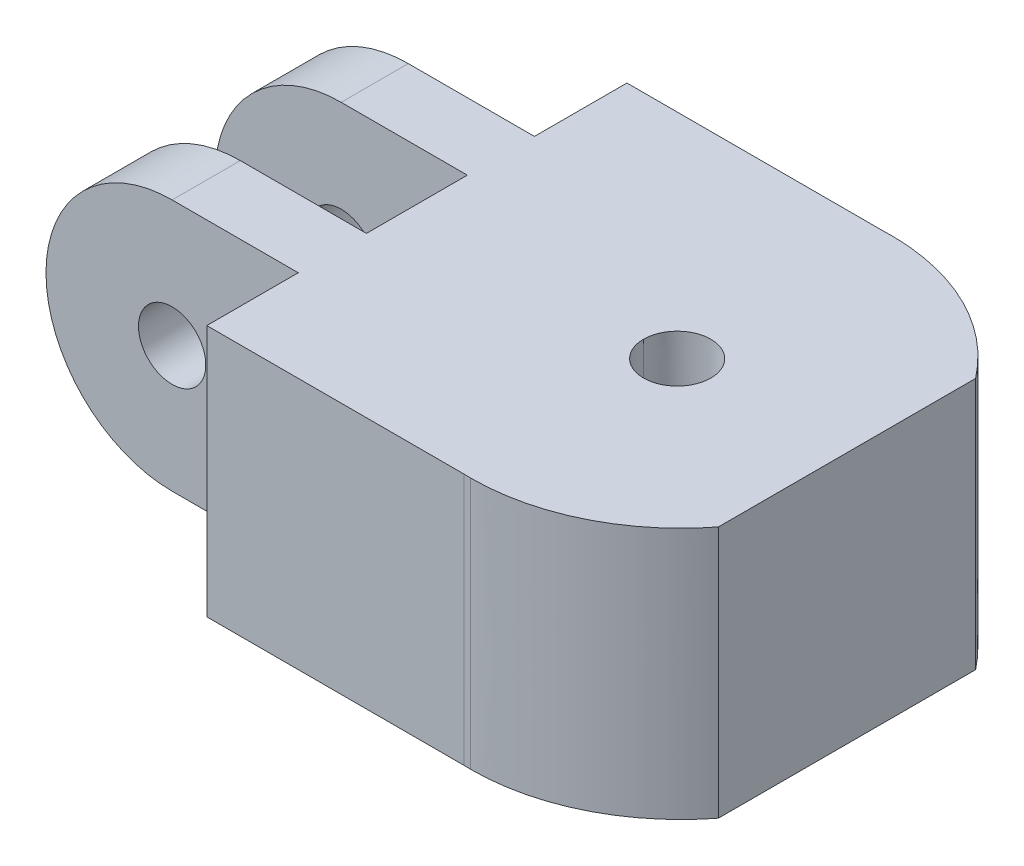
from build123d import *

# Parameters (mm, degrees)
BOSS_EXTRUDE1_DEPTH     = 15
FILLET1_R               = 7.5
SKETCH2_R               = 2
CUT_EXTRUDE1_DEPTH      = 50.895825098
SKETCH3_W               = 16.778198781
SKETCH3_H               = 15
CUT_EXTRUDE2_DEPTH      = 0.5
SKETCH4_W               = 17.069765142
SKETCH4_H               = 15
CUT_EXTRUDE3_DEPTH      = 0.5
CUT_EXTRUDE4_DEPTH      = 5.5
CUT_EXTRUDE4_DEPTH_BACK = 0.5
SKETCH5_W               = 22.968603586
SKETCH5_H               = 20.541854235
SKETCH6_W               = 12.673779453
SKETCH6_H               = 42.424939697
CUT_EXTRUDE5_DEPTH      = 53.100719191


with BuildPart() as part:
    # Sketch1 → Boss-Extrude1 (new body)
    with BuildSketch(Plane(origin=(0, 0, 0), x_dir=(1, 0, 0), z_dir=(0, 1, 0))):
        with BuildLine():
            Line((30.290313035, 24.979698344), (14.999945743, 24.979698344))
            Line((14.999945743, 24.979698344), (14.999945743, 19.979831267))
            Line((14.999945743, 19.979831267), (0.627351888, 19.979831267))
            Line((0.627351888, 19.979831267), (0, 19.979831267))
            Line((0, 19.979831267), (0, 14.979964189))
            Line((0, 14.979964189), (14.999945743, 14.979964189))
            Line((14.999945743, 14.979964189), (14.999945743, 9.990087888))
            Line((14.999945743, 9.990087888), (0.627351888, 9.990087888))
            Line((0.627351888, 9.990087888), (0.627351888, 9.938411456))
            Line((0.627351888, 9.938411456), (0, 9.938411456))
            Line((0, 9.938411456), (0, 4.938544378))
            Line((0, 4.938544378), (14.999945743, 4.938544378))
            Line((14.999945743, 4.938544378), (14.999945743, 0))
            Line((14.999945743, 0), (30.290313035, 0))
            add(Edge.make_bspline(
                [(30.290313035, 0), (30.421915682, -0.004134115), (30.552829311, -0.009990777), (30.685809997, -0.009990777)],
                knots=[15, 15, 15, 15, 16, 16, 16, 16], degree=3))
            add(Edge.make_bspline(
                [(30.685809997, -0.009990777), (37.58909233, -0.009990777), (43.185649946, 5.586222329), (43.185649946, 12.489849172)],
                knots=[16, 16, 16, 16, 17, 17, 17, 17], degree=3))
            add(Edge.make_bspline(
                [(43.185649946, 12.489849172), (43.185649946, 19.393476015), (37.58909233, 24.989689121), (30.685809997, 24.989689121)],
                knots=[17, 17, 17, 17, 18, 18, 18, 18], degree=3))
            add(Edge.make_bspline(
                [(30.685809997, 24.989689121), (30.552829311, 24.989689121), (30.421915682, 24.983832459), (30.290313035, 24.979698344)],
                knots=[0, 0, 0, 0, 1, 1, 1, 1], degree=3))
        make_face()
        with BuildLine():
            add(Edge.make_bspline(
                [(28.685587558, 12.281420895), (28.685587558, 13.385918508), (29.581312384, 14.281298825), (30.685809997, 14.281298825), (31.790307609, 14.281298825), (32.685687926, 13.385918508), (32.685687926, 12.281420895)],
                knots=[2, 2, 2, 2, 3, 3, 3, 4, 4, 4, 4], degree=3))
            add(Edge.make_bspline(
                [(32.685687926, 12.281420895), (32.685687926, 11.176578773), (31.790307609, 10.281198457), (30.685809997, 10.281198457), (29.581312384, 10.281198457), (28.685587558, 11.176578773), (28.685587558, 12.281420895)],
                knots=[0, 0, 0, 0, 1, 1, 1, 2, 2, 2, 2], degree=3))
        make_face(mode=Mode.SUBTRACT)
    extrude(amount=BOSS_EXTRUDE1_DEPTH)

    # Fillet1
    fillet1_edges = [part.edges().sort_by_distance(p)[0] for p in [
        (0, 0, -7.438477917),
        (0, 0, -17.479897728),
        (0, 15, -17.479897728),
        (0, 15, -7.438477917),
    ]]
    fillet(fillet1_edges, radius=FILLET1_R - 0.0001)  # a hair under: the kernel refuses the full size

    # Sketch2 → Cut-Extrude1 (cut, through all)
    with BuildSketch(Plane(origin=(0, 0, -19.979831267), x_dir=(-1, 0, 0), z_dir=(0, 0, -1))):
        with Locations((-7.5, 7.5)):
            Circle(SKETCH2_R)
    extrude(amount=-CUT_EXTRUDE1_DEPTH, mode=Mode.SUBTRACT)

    # Sketch3 → Cut-Extrude2 (cut)
    with BuildSketch(Plane(origin=(0, 0, -19.979831267), x_dir=(-1, 0, 0), z_dir=(0, 0, -1))):
        with Locations((-6.610846353, 7.5)):
            Rectangle(SKETCH3_W, SKETCH3_H)
    extrude(amount=-CUT_EXTRUDE2_DEPTH, mode=Mode.SUBTRACT)

    # Sketch4 → Cut-Extrude3 (cut)
    with BuildSketch(Plane.XY.offset(-4.938544378)):
        with Locations((6.465063172, 7.5)):
            Rectangle(SKETCH4_W, SKETCH4_H)
    extrude(amount=-CUT_EXTRUDE3_DEPTH, mode=Mode.SUBTRACT)

    # Sketch5 → Cut-Extrude4 (cut, two sides: drawn at the far end of the back side and taken through both)
    with BuildSketch(Plane(origin=(0, 0, -9.990087888), x_dir=(-1, 0, 0), z_dir=(0, 0, -1)).offset(-CUT_EXTRUDE4_DEPTH_BACK)):
        with Locations((-3.51564395, 4.729072883)):
            Rectangle(SKETCH5_W, SKETCH5_H)
    extrude(amount=CUT_EXTRUDE4_DEPTH + CUT_EXTRUDE4_DEPTH_BACK, mode=Mode.SUBTRACT)

    # Sketch6 → Cut-Extrude5 (cut, through all)
    with BuildSketch(Plane(origin=(0, 15, 0), x_dir=(1, 0, 0), z_dir=(0, 1, 0))):
        with Locations((46.913532653, 9.965833772)):
            Rectangle(SKETCH6_W, SKETCH6_H)
    extrude(amount=-CUT_EXTRUDE5_DEPTH, mode=Mode.SUBTRACT)


solid = part.part
